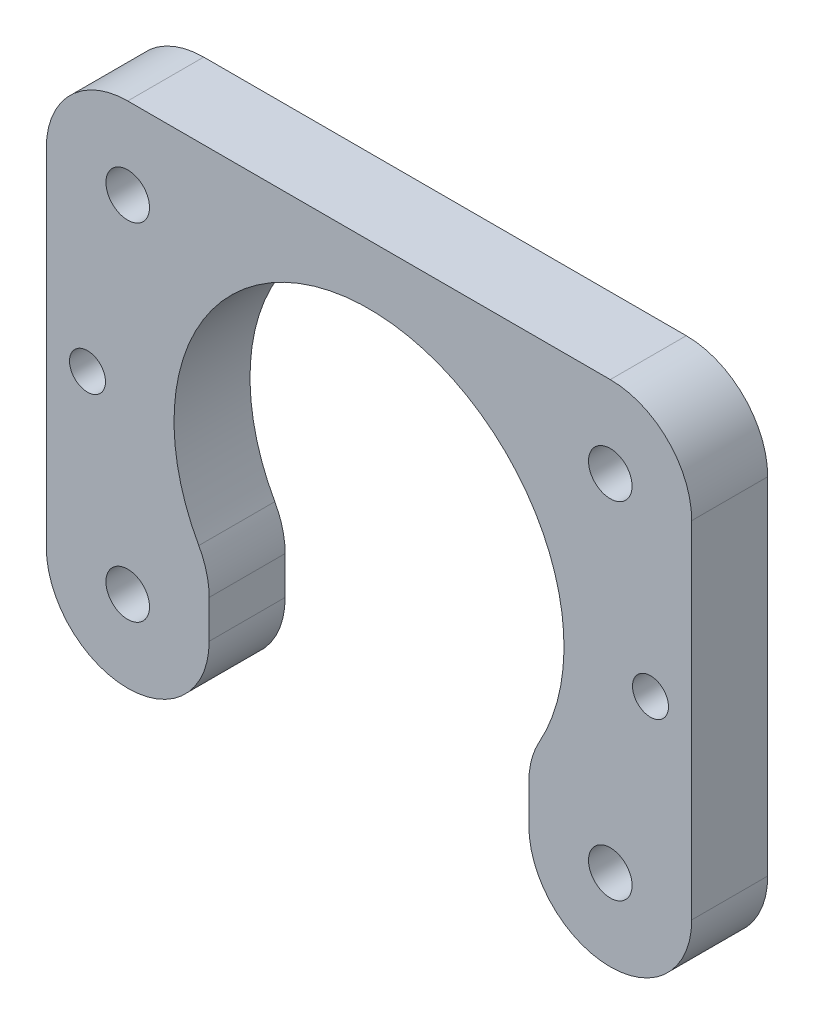
from build123d import *

# Parameters (mm, degrees)
SKETCH1_W              = 50.8
SKETCH1_H              = 40
BOSS_EXTRUDE1_DEPTH    = 6
SKETCH10_R             = 1.8
M3_THROUGH_DEPTH       = 55.923947418
CUT_EXTRUDE2_DEPTH     = 55.923947418
FILLET1_R              = 6.35
SKETCH8_R              = 1.5
CUT_EXTRUDE1_DEPTH     = 55.923947418
MOVE_FACE1_OUTLINE_R   = 1.8
MOVE_FACE1_OUTLINE_R_2 = 1.72
MOVE_FACE1_OUTLINE_R_3 = 1.5
MOVE_FACE1_OUTLINE_R_4 = 1.42
MOVE_FACE1_DEPTH       = 6


# Read off the part's stored shape, not the designer's step: Move Face1
with BuildPart() as part:
    # Sketch1 → Boss-Extrude1 (new body)
    with BuildSketch(Plane.XY):
        with Locations((25.4, 0)):
            Rectangle(SKETCH1_W, SKETCH1_H)
    extrude(amount=BOSS_EXTRUDE1_DEPTH)

    # Sketch10 → M3-through (cut, through all)
    with BuildSketch(Plane.XY.offset(6)):
        with Locations((44.45, 13.65)):
            Circle(SKETCH10_R)
        with Locations(Location((44.45, -13.65, 0), (0, 0, 180))):
            Circle(SKETCH10_R)
        with Locations((6.35, -13.65)):
            Circle(SKETCH10_R)
        with Locations(Location((6.35, 13.65, 0), (0, 0, 180))):
            Circle(SKETCH10_R)
    extrude(amount=-M3_THROUGH_DEPTH, mode=Mode.SUBTRACT)

    # Sketch9 → Cut-Extrude2 (cut, through all)
    with BuildSketch(Plane.XY.offset(6)):
        with BuildLine():
            Line((12.7, -8.842263568), (12.7, -20))
            Line((12.7, -20), (38.1, -20))
            Line((38.1, -20), (38.1, -8.842263568))
            ThreePointArc((38.1, -8.842263568), (25.4, 15.475), (12.7, -8.842263568))
        make_face()
    extrude(amount=-CUT_EXTRUDE2_DEPTH, mode=Mode.SUBTRACT)

    # Fillet1
    fillet1_edges = [part.edges().sort_by_distance(p)[0] for p in [
        (0, -20, 3),
        (50.8, -20, 3),
        (50.8, 20, 3),
        (0, 20, 3),
        (38.1, -20, 3),
        (38.1, -8.842263568, 3),
        (12.7, -8.842263568, 3),
        (12.7, -20, 3),
    ]]
    fillet(fillet1_edges, radius=FILLET1_R - 0.0001)  # a hair under: the kernel refuses the full size

    # Sketch8 → Cut-Extrude1 (cut, through all)
    with BuildSketch(Plane.XY.offset(6)):
        with Locations((47.625, 0)):
            Circle(SKETCH8_R)
        with Locations((3.175, 0)):
            Circle(SKETCH8_R)
    extrude(amount=-CUT_EXTRUDE1_DEPTH, mode=Mode.SUBTRACT)

    # Move Face1 outline → Move Face1 (add)
    # profile 1 of 7: a face of its own
    with BuildSketch(Plane.XY):
        with BuildLine():
            Line((-0.08, 13.65), (-0.08, -13.65))
            ThreePointArc((-0.08, -13.65), (1.803303397, -18.196696603), (6.35, -20.08))
            ThreePointArc((6.35, -20.08), (10.896696603, -18.196696603), (12.78, -13.65))
            Line((12.78, -13.65), (12.78, -10.650264081))
            ThreePointArc((12.78, -10.650264081), (12.572253945, -9.029012761), (11.962439863, -7.512523048))
            ThreePointArc((11.962439863, -7.512523048), (25.4, 15.395), (38.837560137, -7.512523048))
            ThreePointArc((38.837560137, -7.512523048), (38.227746055, -9.029012761), (38.02, -10.650264081))
            Line((38.02, -10.650264081), (38.02, -13.65))
            ThreePointArc((38.02, -13.65), (39.903303397, -18.196696603), (44.45, -20.08))
            ThreePointArc((44.45, -20.08), (48.996696603, -18.196696603), (50.88, -13.65))
            Line((50.88, -13.65), (50.88, 13.65))
            ThreePointArc((50.88, 13.65), (48.996696603, 18.196696603), (44.45, 20.08))
            Line((44.45, 20.08), (6.35, 20.08))
            ThreePointArc((6.35, 20.08), (1.803303397, 18.196696603), (-0.08, 13.65))
        make_face()
        with BuildLine():
            ThreePointArc((6.35, -20), (1.859871939, -18.140128061), (0, -13.65))
            Line((0, -13.65), (0, 13.65))
            ThreePointArc((0, 13.65), (1.859871939, 18.140128061), (6.35, 20))
            Line((6.35, 20), (44.45, 20))
            ThreePointArc((44.45, 20), (48.940128061, 18.140128061), (50.8, 13.65))
            Line((50.8, 13.65), (50.8, -13.65))
            ThreePointArc((50.8, -13.65), (48.940128061, -18.140128061), (44.45, -20))
            ThreePointArc((44.45, -20), (39.959871939, -18.140128061), (38.1, -13.65))
            Line((38.1, -13.65), (38.1, -10.650264081))
            ThreePointArc((38.1, -10.650264081), (38.305161345, -9.049183851), (38.907388316, -7.551561817))
            ThreePointArc((38.907388316, -7.551561817), (25.4, 15.475), (11.892611684, -7.551561817))
            ThreePointArc((11.892611684, -7.551561817), (12.494838655, -9.049183851), (12.7, -10.650264081))
            Line((12.7, -10.650264081), (12.7, -13.65))
            ThreePointArc((12.7, -13.65), (10.840128061, -18.140128061), (6.35, -20))
        make_face(mode=Mode.SUBTRACT)
    # profile 2 of 7: a face of its own
    with BuildSketch(Plane.XY):
        with Locations((44.45, 13.65)):
            Circle(MOVE_FACE1_OUTLINE_R)
        with Locations((44.45, 13.65)):
            Circle(MOVE_FACE1_OUTLINE_R_2, mode=Mode.SUBTRACT)
    # profile 3 of 7: a face of its own
    with BuildSketch(Plane.XY):
        with Locations((44.45, -13.65)):
            Circle(MOVE_FACE1_OUTLINE_R)
        with Locations((44.45, -13.65)):
            Circle(MOVE_FACE1_OUTLINE_R_2, mode=Mode.SUBTRACT)
    # profile 4 of 7: a face of its own
    with BuildSketch(Plane.XY):
        with Locations((6.35, -13.65)):
            Circle(MOVE_FACE1_OUTLINE_R)
        with Locations((6.35, -13.65)):
            Circle(MOVE_FACE1_OUTLINE_R_2, mode=Mode.SUBTRACT)
    # profile 5 of 7: a face of its own
    with BuildSketch(Plane.XY):
        with Locations((6.35, 13.65)):
            Circle(MOVE_FACE1_OUTLINE_R)
        with Locations((6.35, 13.65)):
            Circle(MOVE_FACE1_OUTLINE_R_2, mode=Mode.SUBTRACT)
    # profile 6 of 7: a face of its own
    with BuildSketch(Plane.XY):
        with Locations((47.625, 0)):
            Circle(MOVE_FACE1_OUTLINE_R_3)
        with Locations((47.625, 0)):
            Circle(MOVE_FACE1_OUTLINE_R_4, mode=Mode.SUBTRACT)
    # profile 7 of 7: a face of its own
    with BuildSketch(Plane.XY):
        with Locations((3.175, 0)):
            Circle(MOVE_FACE1_OUTLINE_R_3)
        with Locations((3.175, 0)):
            Circle(MOVE_FACE1_OUTLINE_R_4, mode=Mode.SUBTRACT)
    extrude(amount=MOVE_FACE1_DEPTH)


solid = part.part
